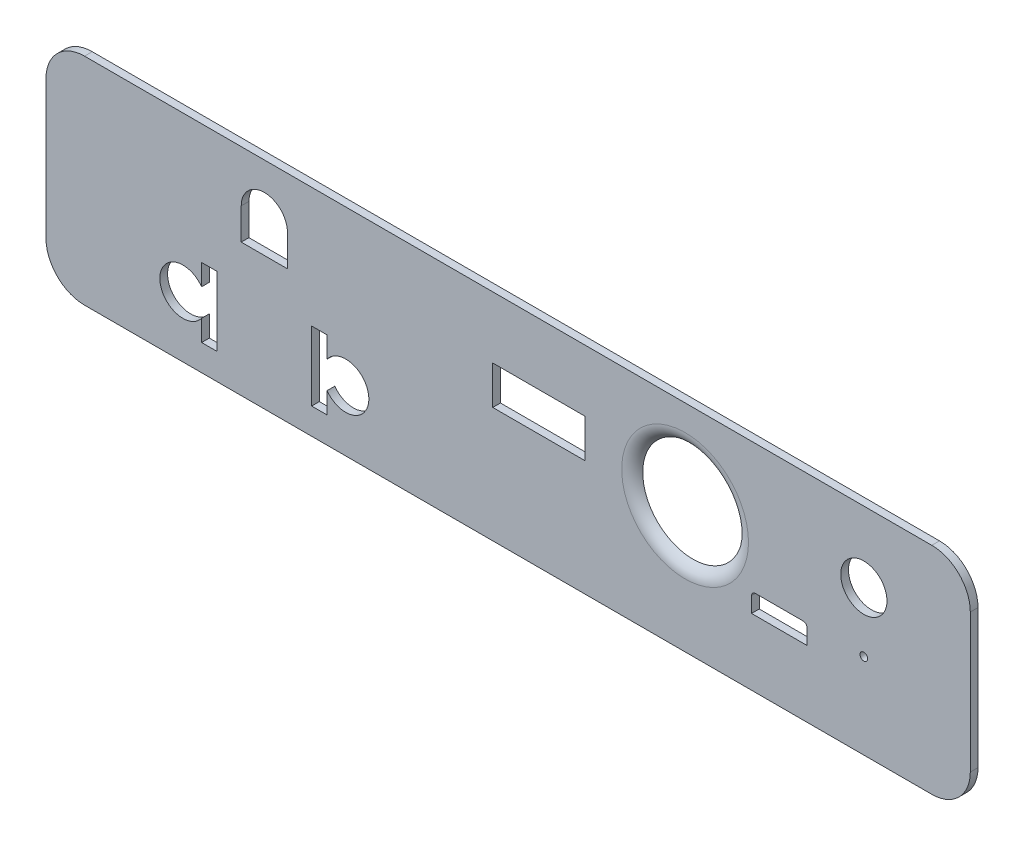
from build123d import *

# Parameters (mm, degrees)
BOSS_EXTRUDE1_DEPTH      = 1
SKETCH11_W               = 12
SKETCH11_H               = 5
CUT_EXTRUDE7_DEPTH       = 10
SKETCH13_R               = 3
CUT_EXTRUDE9_DEPTH       = 10
CUT_EXTRUDE10_DEPTH      = 10
SKETCH21_R               = 6.5
CUT_EXTRUDE11_DEPTH      = 10
CUT_EXTRUDE17_DEPTH      = 10
CUT_EXTRUDE17_DEPTH_BACK = 10
SKETCH23_W               = 2
SKETCH23_H               = 4
BOSS_EXTRUDE2_DEPTH      = 3
SKETCH24_W               = 2
SKETCH24_H               = 3.949234692
BOSS_EXTRUDE3_DEPTH      = 3
FILLET1_R                = 2
SKETCH25_R               = 0.5
CUT_EXTRUDE18_DEPTH      = 10


with BuildPart() as part:
    # Sketch4 → Boss-Extrude1 (new body)
    with BuildSketch(Plane.XY):
        with BuildLine():
            Line((55, 14.052488348), (0, 14.052488348))
            Line((0, 14.052488348), (-55, 14.052488348))
            ThreePointArc((-55, 14.052488348), (-58.535533906, 12.588022254), (-60, 9.052488348))
            Line((-60, 9.052488348), (-60, -8.947511652))
            ThreePointArc((-60, -8.947511652), (-58.535533906, -12.483045558), (-55, -13.947511652))
            Line((-55, -13.947511652), (0, -13.947511652))
            Line((0, -13.947511652), (55, -13.947511652))
            ThreePointArc((55, -13.947511652), (58.535533906, -12.483045558), (60, -8.947511652))
            Line((60, -8.947511652), (60, 9.052488348))
            ThreePointArc((60, 9.052488348), (58.535533906, 12.588022254), (55, 14.052488348))
        make_face()
    extrude(amount=BOSS_EXTRUDE1_DEPTH)

    # Sketch11 → Cut-Extrude7 (cut)
    with BuildSketch(Plane.XY.offset(1)):
        with Locations((4, 3.552488348)):
            Rectangle(SKETCH11_W, SKETCH11_H)
    extrude(amount=-CUT_EXTRUDE7_DEPTH, mode=Mode.SUBTRACT)

    # Sketch13 → Cut-Extrude9 (cut)
    with BuildSketch(Plane.XY.offset(1)):
        with Locations((46.180246868, 4.878767266)):
            Circle(SKETCH13_R)
    extrude(amount=-CUT_EXTRUDE9_DEPTH, mode=Mode.SUBTRACT)

    # Sketch12 → Cut-Extrude10 (cut)
    with BuildSketch(Plane.XY.offset(1)):
        with BuildLine():
            Line((38.300111452, -2.809077948), (32.100111452, -2.809077948))
            ThreePointArc((32.100111452, -2.809077948), (31.746558061, -2.955524558), (31.600111452, -3.309077948))
            Line((31.600111452, -3.309077948), (31.600111452, -5.309077948))
            Line((31.600111452, -5.309077948), (38.800111452, -5.309077948))
            Line((38.800111452, -5.309077948), (38.800111452, -3.309077948))
            ThreePointArc((38.800111452, -3.309077948), (38.653664842, -2.955524558), (38.300111452, -2.809077948))
        make_face()
    extrude(amount=-CUT_EXTRUDE10_DEPTH, mode=Mode.SUBTRACT)

    # Sketch21 → Cut-Extrude11 (cut)
    with BuildSketch(Plane.XY.offset(1)):
        with Locations((22.972397633, 2.485770253)):
            Circle(SKETCH21_R)
    extrude(amount=-CUT_EXTRUDE11_DEPTH, mode=Mode.SUBTRACT)

    # Sketch22 → Cut-Extrude17 (cut, two sides: drawn at the far end of the back side and taken through both)
    with BuildSketch(Plane.XY.offset(-CUT_EXTRUDE17_DEPTH_BACK)):
        with BuildLine():
            Line((-39.794789509, -7.812631563), (-39.794789509, -10.545937078))
            Line((-39.794789509, -10.545937078), (-37.794789509, -10.545937078))
            Line((-37.794789509, -10.545937078), (-37.794789509, -1.545937078))
            Line((-37.794789509, -1.545937078), (-39.794789509, -1.545937078))
            Line((-39.794789509, -1.545937078), (-39.794789509, -4.279242592))
            ThreePointArc((-39.794789509, -4.279242592), (-45.219411252, -6.045937078), (-39.794789509, -7.812631563))
        make_face()
        with BuildLine():
            Line((-25.510698687, -1.545937078), (-23.510698687, -1.545937078))
            Line((-23.510698687, -1.545937078), (-23.510698687, -4.279242592))
            ThreePointArc((-23.510698687, -4.279242592), (-18.086076945, -6.045937078), (-23.510698687, -7.812631563))
            Line((-23.510698687, -7.812631563), (-23.510698687, -10.545937078))
            Line((-23.510698687, -10.545937078), (-25.510698687, -10.545937078))
            Line((-25.510698687, -10.545937078), (-25.510698687, -1.545937078))
        make_face()
        with BuildLine():
            Line((-31.652744098, 3.313523563), (-34.652744098, 3.313523563))
            Line((-34.652744098, 3.313523563), (-34.652744098, 7.397933855))
            ThreePointArc((-34.652744098, 7.397933855), (-31.652744098, 10.397933855), (-28.652744098, 7.397933855))
            Line((-28.652744098, 7.397933855), (-28.652744098, 3.313523563))
            Line((-28.652744098, 3.313523563), (-31.652744098, 3.313523563))
        make_face()
    extrude(amount=CUT_EXTRUDE17_DEPTH + CUT_EXTRUDE17_DEPTH_BACK, mode=Mode.SUBTRACT)

    # Sketch23 → Boss-Extrude2 (add)
    with BuildSketch(Plane(origin=(0, 0, 0), x_dir=(-1, 0, 0), z_dir=(0, 0, -1))):
        with Locations((-55.128215007, 1.148016517)):
            Rectangle(SKETCH23_W, SKETCH23_H)
    extrude(amount=BOSS_EXTRUDE2_DEPTH)

    # Sketch24 → Boss-Extrude3 (add)
    with BuildSketch(Plane(origin=(0, 0, 0), x_dir=(-1, 0, 0), z_dir=(0, 0, -1))):
        with Locations((55.13, 1.173399171)):
            Rectangle(SKETCH24_W, SKETCH24_H)
    extrude(amount=BOSS_EXTRUDE3_DEPTH)

    # Fillet1
    # the kernel refuses this fillet: 2 mm, written as the material it takes off along each edge
    with BuildSketch(Plane(origin=(22.972397633, 2.485770253, 1), x_dir=(1, 0, 0), z_dir=(0, -1, 0))) as fillet1_piece_1:
        with BuildLine():
            CenterArc((8.232050808, -2), FILLET1_R, 90, 60)
            Line((6.5, -1), (6.465358984, -0.98))
            ThreePointArc((6.465358984, -0.98), (6.46, -0.5), (6.46, 0))
            Line((6.46, 0), (6.5, 0.04))
            Line((6.5, 0.04), (8.232050808, 0.04))
            Line((8.232050808, 0.04), (8.232050808, 0))
        make_face()
    revolve(axis=Axis((22.972397633, 2.485770253, 1), (0, 0, 1)), mode=Mode.SUBTRACT)

    # Sketch25 → Cut-Extrude18 (cut)
    with BuildSketch(Plane.XY.offset(1)):
        with Locations((46.180246868, -2.877511652)):
            Circle(SKETCH25_R)
    extrude(amount=-CUT_EXTRUDE18_DEPTH, mode=Mode.SUBTRACT)


solid = part.part
